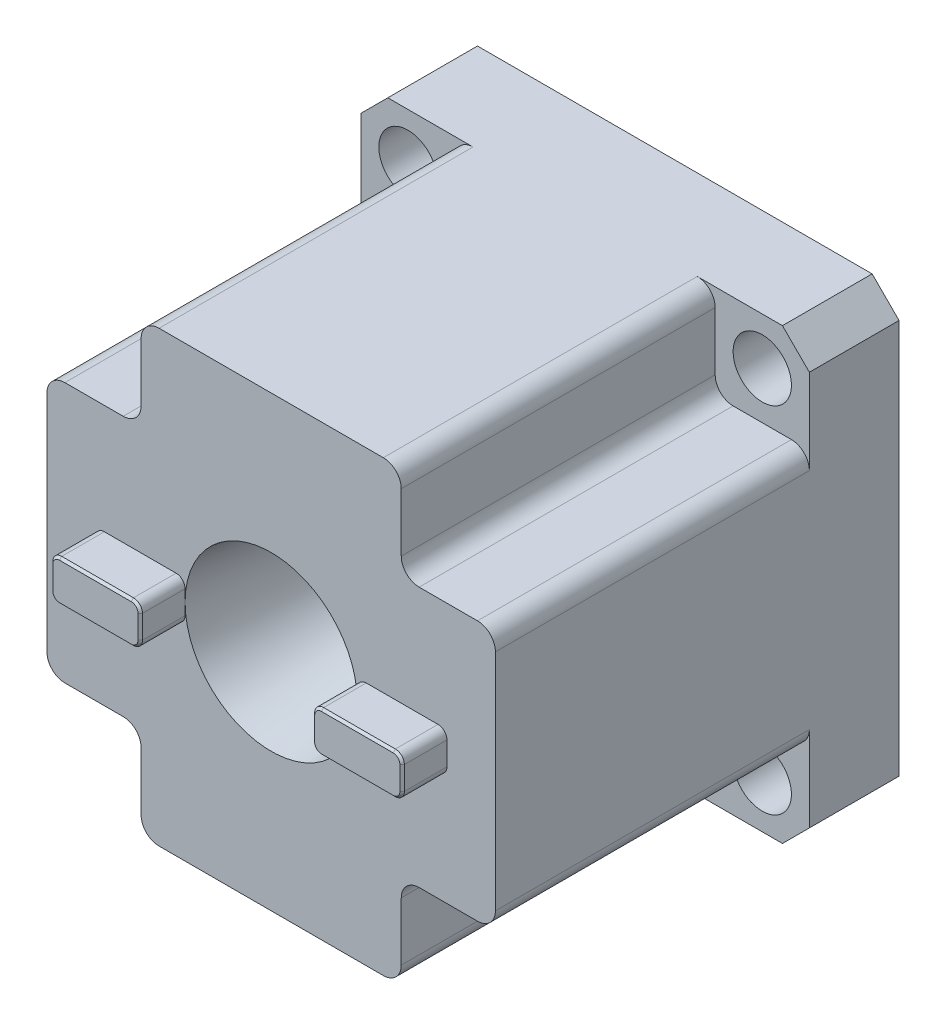
from build123d import *

# Parameters (mm, degrees)
SKETCH_1_W          = 50
SKETCH_1_H          = 50
EXTRUDE_1_DEPTH     = 45
SKETCH_4_W          = 10.5
SKETCH_4_H          = 10.5
CUT_EXTRUDE_1_DEPTH = 35
FILLET_1_R          = 2
CHAMFER_1_SIZE      = 3
SKETCH_5_R          = 3.25
CUT_EXTRUDE_2_DEPTH = 79.89866919
SKETCH_7_W          = 10
SKETCH_7_H          = 4.6
EXTRUDE_4_DEPTH     = 5
FILLET_2_R          = 1
CHAMFER_2_SIZE      = 0.25


with BuildPart() as part:
    # 草图1 → 凸台-拉伸1 (new body)
    with BuildSketch(Plane.XY):
        with Locations((25, -25)):
            Rectangle(SKETCH_1_W, SKETCH_1_H)
    extrude(amount=EXTRUDE_1_DEPTH)

    # 草图4 → 切除-拉伸1 (cut)
    with BuildSketch(Plane.XY.offset(45)):
        with Locations((5.25, -5.25)):
            Rectangle(SKETCH_4_W, SKETCH_4_H)
        with Locations((44.75, -5.25)):
            Rectangle(SKETCH_4_W, SKETCH_4_H)
        with Locations((44.75, -44.75)):
            Rectangle(SKETCH_4_W, SKETCH_4_H)
        with Locations((5.25, -44.75)):
            Rectangle(SKETCH_4_W, SKETCH_4_H)
    extrude(amount=-CUT_EXTRUDE_1_DEPTH, mode=Mode.SUBTRACT)

    # 圆角1
    fillet_1_edges = [part.edges().sort_by_distance(p)[0] for p in [
        (0, -39.5, 27.5),
        (10.5, -39.5, 27.5),
        (10.5, -50, 27.5),
        (39.5, -50, 27.5),
        (39.5, -39.5, 27.5),
        (50, -39.5, 27.5),
        (50, -10.5, 27.5),
        (39.5, -10.5, 27.5),
        (39.5, 0, 27.5),
        (10.5, 0, 27.5),
        (10.5, -10.5, 27.5),
        (0, -10.5, 27.5),
    ]]
    fillet(fillet_1_edges, radius=FILLET_1_R)

    # 倒角1
    chamfer_1_edges = [part.edges().sort_by_distance(p)[0] for p in [
        (50, -50, 5),
        (0, -50, 5),
        (0, 0, 5),
        (50, 0, 5),
    ]]
    chamfer(chamfer_1_edges, length=CHAMFER_1_SIZE)

    # 草图5 → 切除-拉伸2 (cut, through all)
    with BuildSketch(Plane.XY.offset(10)):
        with Locations((5.25, -5.25)):
            Circle(SKETCH_5_R)
        with Locations((44.75, -5.25)):
            Circle(SKETCH_5_R)
        with Locations((44.75, -44.75)):
            Circle(SKETCH_5_R)
        with Locations((5.25, -44.75)):
            Circle(SKETCH_5_R)
    extrude(amount=-CUT_EXTRUDE_2_DEPTH, mode=Mode.SUBTRACT)

    # 草图6 → 切除-旋转1 (revolve, cut)
    with BuildSketch(Plane(origin=(25, 0, 0), x_dir=(0, 0, -1), z_dir=(1, 0, 0))):
        Polygon((-45, -15.4), (-45, -25), (0, -25), (0, -19), (-20.314285805, -19), align=None)
    revolve(axis=Axis((25, -25, 0), (0, 0, 1)), mode=Mode.SUBTRACT)

    # 草图7 → 凸台-拉伸4 (add)
    with BuildSketch(Plane.XY.offset(45)):
        with Locations((39.6, -25)):
            Rectangle(SKETCH_7_W, SKETCH_7_H)
        with Locations((10.4, -25)):
            Rectangle(SKETCH_7_W, SKETCH_7_H)
    extrude(amount=EXTRUDE_4_DEPTH)

    # 圆角2
    fillet_2_edges = [part.edges().sort_by_distance(p)[0] for p in [
        (5.4, -22.7, 47.5),
        (5.4, -27.3, 47.5),
        (15.4, -27.3, 47.5),
        (15.4, -22.7, 47.5),
        (34.6, -22.7, 47.5),
        (44.6, -22.7, 47.5),
        (34.6, -27.3, 47.5),
        (44.6, -27.3, 47.5),
    ]]
    fillet(fillet_2_edges, radius=FILLET_2_R)

    # 倒角2
    chamfer_2_edges = [part.edges().sort_by_distance(p)[0] for p in [
        (44.307106781, -22.992893219, 50),
        (44.6, -25, 50),
        (44.307106781, -27.007106781, 50),
        (39.6, -27.3, 50),
        (34.892893219, -27.007106781, 50),
        (34.6, -25, 50),
        (34.892893219, -22.992893219, 50),
        (39.6, -22.7, 50),
        (15.107106781, -22.992893219, 50),
        (15.4, -25, 50),
        (15.107106781, -27.007106781, 50),
        (10.4, -27.3, 50),
        (5.692893219, -27.007106781, 50),
        (5.4, -25, 50),
        (5.692893219, -22.992893219, 50),
        (10.4, -22.7, 50),
    ]]
    chamfer(chamfer_2_edges, length=CHAMFER_2_SIZE)


solid = part.part
